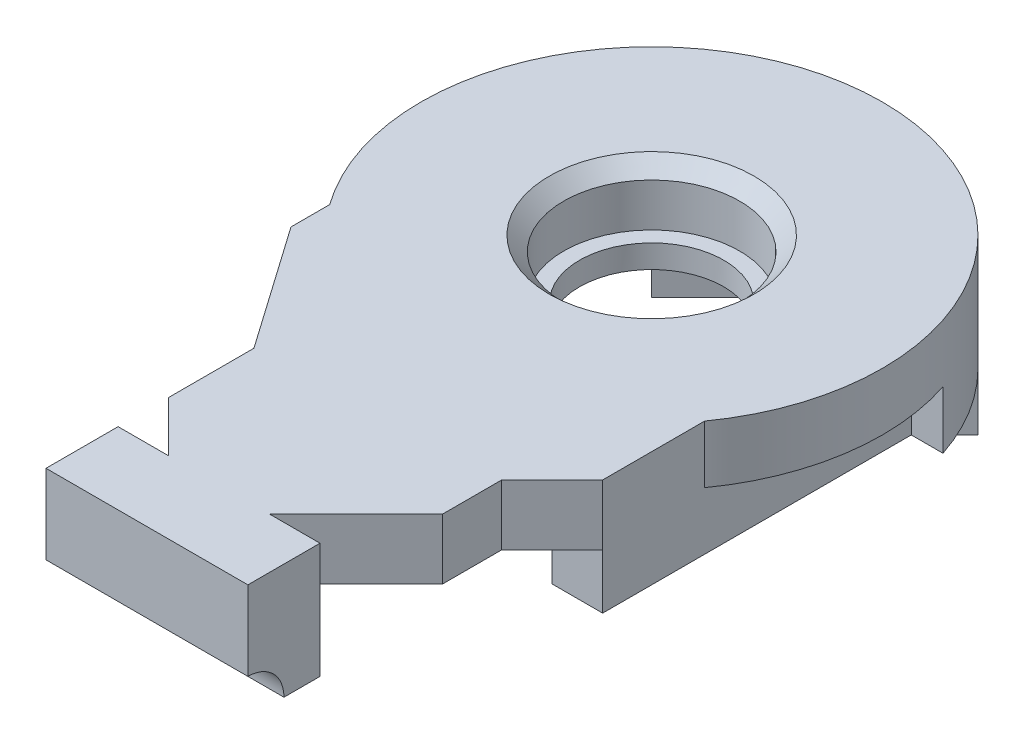
from build123d import *

# Parameters (mm, degrees)
BOSS_EXTRUDE1_DEPTH      = 4
SKETCH2_R                = 2.5
CUT_EXTRUDE1_DEPTH       = 22.9089023
SKETCH3_R                = 3.05
CUT_EXTRUDE2_DEPTH       = 2
CUT_EXTRUDE3_DEPTH       = 1.2
CUT_EXTRUDE5_DEPTH       = 0.7
CUT_EXTRUDE8_START       = -2
CUT_EXTRUDE8_DEPTH       = 2
BOSS_EXTRUDE3_DEPTH      = 2
BOSS_EXTRUDE4_DEPTH      = 1.9
CUT_EXTRUDE10_DEPTH      = 22.9089023
CUT_EXTRUDE10_DEPTH_BACK = 22.9089023
CUT_EXTRUDE11_DEPTH      = 23.360679775
CUT_EXTRUDE12_DEPTH      = 24.837994882
CUT_EXTRUDE12_DEPTH_BACK = 24.837994882
CHAMFER1_SIZE            = 1.75
CUT_EXTRUDE13_DEPTH      = 24.837994882
CUT_EXTRUDE14_DEPTH      = 21.155644371
CHAMFER2_SIZE            = 0.5


with BuildPart() as part:
    # Sketch1 → Boss-Extrude1 (new body)
    with BuildSketch(Plane(origin=(0, 0, 0), x_dir=(1, 0, 0), z_dir=(0, 1, 0))):
        with BuildLine():
            Line((-6.5, -20), (6.5, -20))
            Line((6.5, -20), (6.5, -4.663689527))
            ThreePointArc((6.5, -4.663689527), (8, 0), (6.5, 4.663689527))
            ThreePointArc((6.5, 4.663689527), (0, 8), (-6.5, 4.663689527))
            ThreePointArc((-6.5, 4.663689527), (-8, 0), (-6.5, -4.663689527))
            Line((-6.5, -4.663689527), (-6.5, -20))
        make_face()
    extrude(amount=-BOSS_EXTRUDE1_DEPTH)

    # Sketch2 → Cut-Extrude1 (cut, through all)
    with BuildSketch(Plane(origin=(0, 0, 0), x_dir=(1, 0, 0), z_dir=(0, 1, 0))):
        with Locations(Location((0, 0, 0), (0, 0, 270))):
            Circle(SKETCH2_R)
    extrude(amount=-CUT_EXTRUDE1_DEPTH, mode=Mode.SUBTRACT)

    # Sketch3 → Cut-Extrude2 (cut)
    with BuildSketch(Plane(origin=(0, 0, 0), x_dir=(1, 0, 0), z_dir=(0, 1, 0))):
        with Locations(Location((0, 0, 0), (0, 0, 270))):
            Circle(SKETCH3_R)
    extrude(amount=-CUT_EXTRUDE2_DEPTH, mode=Mode.SUBTRACT)

    # Sketch4 → Cut-Extrude3 (cut)
    with BuildSketch(Plane.XZ.offset(4)):
        Polygon((2.5, -5.75), (-2.5, -5.75), (-5.75, -2.5), (-5.75, 6.75), (-4.75, 6.75), (-4.75, 8.2), (-6.010373569, 10), (-6.5, 10), (-6.5, 10.699259012), (-6.5, 15), (6.5, 15), (6.5, 10.699259012), (6.5, 10), (6.5, 8.2), (4.75, 8.2), (4.75, 6.75), (5.75, 6.75), (5.75, -2.5), align=None)
    extrude(amount=-CUT_EXTRUDE3_DEPTH, mode=Mode.SUBTRACT)

    # Sketch6 → Cut-Extrude5 (cut)
    with BuildSketch(Plane.XZ.offset(2.8)):
        Polygon((6.5, 8.2), (6.5, 15), (-6.5, 15), (-6.5, 10.699259012), (-6.010373569, 10), (-4.75, 8.2), (-4.75, 6.2), (4.75, 6.2), (4.75, 8.2), align=None)
    extrude(amount=-CUT_EXTRUDE5_DEPTH, mode=Mode.SUBTRACT)

    # Sketch10 → Cut-Extrude8 (cut)
    with BuildSketch(Plane.XZ.offset(4).offset(CUT_EXTRUDE8_START)):
        with BuildLine():
            Line((-6.5, 4.663689527), (-6.5, -2.5))
            Line((-6.5, -2.5), (-7.599342077, -2.5))
            ThreePointArc((-7.599342077, -2.5), (-7.907431546, 1.213476964), (-6.5, 4.663689527))
        make_face()
        with BuildLine():
            Line((6.5, 4.663689527), (6.5, -2.5))
            Line((6.5, -2.5), (7.599342077, -2.5))
            ThreePointArc((7.599342077, -2.5), (7.907431546, 1.213476964), (6.5, 4.663689527))
        make_face()
    extrude(amount=CUT_EXTRUDE8_DEPTH, mode=Mode.SUBTRACT)

    # Sketch11 → Boss-Extrude3 (add)
    with BuildSketch(Plane.XZ.offset(4)):
        with BuildLine():
            Line((-0.75, -7.964766161), (-0.75, -5.75))
            Line((-0.75, -5.75), (-2.5, -5.75))
            Line((-2.5, -5.75), (-4.125, -4.125))
            Line((-4.125, -4.125), (-5.656854249, -5.656854249))
            ThreePointArc((-5.656854249, -5.656854249), (-3.404931672, -7.239229262), (-0.75, -7.964766161))
        make_face()
        with BuildLine():
            Line((0.75, -7.964766161), (0.75, -5.75))
            Line((0.75, -5.75), (2.5, -5.75))
            Line((2.5, -5.75), (4.125, -4.125))
            Line((4.125, -4.125), (5.656854249, -5.656854249))
            ThreePointArc((5.656854249, -5.656854249), (3.404931672, -7.239229262), (0.75, -7.964766161))
        make_face()
    extrude(amount=BOSS_EXTRUDE3_DEPTH)

    # Sketch14 → Boss-Extrude4 (add)
    with BuildSketch(Plane.XZ.offset(2.1)):
        Polygon((-4.75, 8.2), (-6.010373569, 10), (-6.5, 10), (-6.5, 15), (-4.75, 15), align=None)
    extrude(amount=BOSS_EXTRUDE4_DEPTH)

    # Sketch15 → Cut-Extrude10 (cut, two sides: drawn at the far end of the back side and taken through both)
    with BuildSketch(Plane.XZ.offset(4).offset(-CUT_EXTRUDE10_DEPTH_BACK)):
        Polygon((-6.5, 15), (-6.5, 8.2), (-4.75, 8.2), (-4.75, 15), (-3.5, 15), (-3.5, 20), (-6.5, 20), align=None)
        Polygon((6.5, 8.2), (4.75, 8.2), (4.75, 15), (3.5, 15), (3.5, 20), (6.5, 20), (6.5, 15), align=None)
    extrude(amount=CUT_EXTRUDE10_DEPTH + CUT_EXTRUDE10_DEPTH_BACK, mode=Mode.SUBTRACT)

    # Sketch16 → Cut-Extrude11 (cut, through all)
    with BuildSketch(Plane(origin=(0, 0, 0), x_dir=(1, 0, 0), z_dir=(0, 1, 0))):
        Polygon((-1.75, -15), (-4.75, -12), (-4.75, -15), (-3.5, -15), align=None)
        Polygon((4.75, -12), (4.75, -15), (1.75, -15), align=None)
    extrude(amount=-CUT_EXTRUDE11_DEPTH, mode=Mode.SUBTRACT)

    # Sketch17 → Cut-Extrude12 (cut, two sides: drawn at the far end of the back side and taken through both)
    with BuildSketch(Plane(origin=(3.5, 0, 0), x_dir=(0, 0, -1), z_dir=(1, 0, 0)).offset(-CUT_EXTRUDE12_DEPTH_BACK)):
        with BuildLine():
            Line((-16.25, -4), (-18.75, -4))
            ThreePointArc((-18.75, -4), (-17.5, -2.75), (-16.25, -4))
        make_face()
    extrude(amount=CUT_EXTRUDE12_DEPTH + CUT_EXTRUDE12_DEPTH_BACK, mode=Mode.SUBTRACT)

    # Chamfer1
    chamfer1_edges = [part.edges().sort_by_distance(p)[0] for p in [
        (-4.75, -1.05, 8.2),
        (4.75, -1.05, 8.2),
    ]]
    chamfer(chamfer1_edges, length=CHAMFER1_SIZE - 0.0001)  # a hair under: the kernel refuses the full size

    # Sketch18 → Cut-Extrude13 (cut, through all)
    with BuildSketch(Plane(origin=(3.5, 0, 0), x_dir=(0, 0, -1), z_dir=(1, 0, 0))):
        with BuildLine():
            Line((-18.75, -4), (-20, -4))
            Line((-20, -4), (-20, 0))
            Line((-20, 0), (-18.75, 0))
            Line((-18.75, 0), (-17.5, 0))
            Line((-17.5, 0), (-17.5, -2.75))
            ThreePointArc((-17.5, -2.75), (-18.383883476, -3.116116524), (-18.75, -4))
        make_face()
    extrude(amount=-CUT_EXTRUDE13_DEPTH, mode=Mode.SUBTRACT)

    # Sketch19 → Cut-Extrude14 (cut, through all)
    with BuildSketch(Plane(origin=(0, 0, 0), x_dir=(1, 0, 0), z_dir=(0, 1, 0))):
        Polygon((-3.5, -10.290482648), (-6.5, -6.006038628), (-6.5, -13.25), (-3.5, -13.25), align=None)
    extrude(amount=-CUT_EXTRUDE14_DEPTH, mode=Mode.SUBTRACT)

    # Chamfer2
    chamfer2_edges = [part.edges().sort_by_distance(p)[0] for p in [
        (0, 0, -3.05),
    ]]
    chamfer(chamfer2_edges, length=CHAMFER2_SIZE)


solid = part.part
